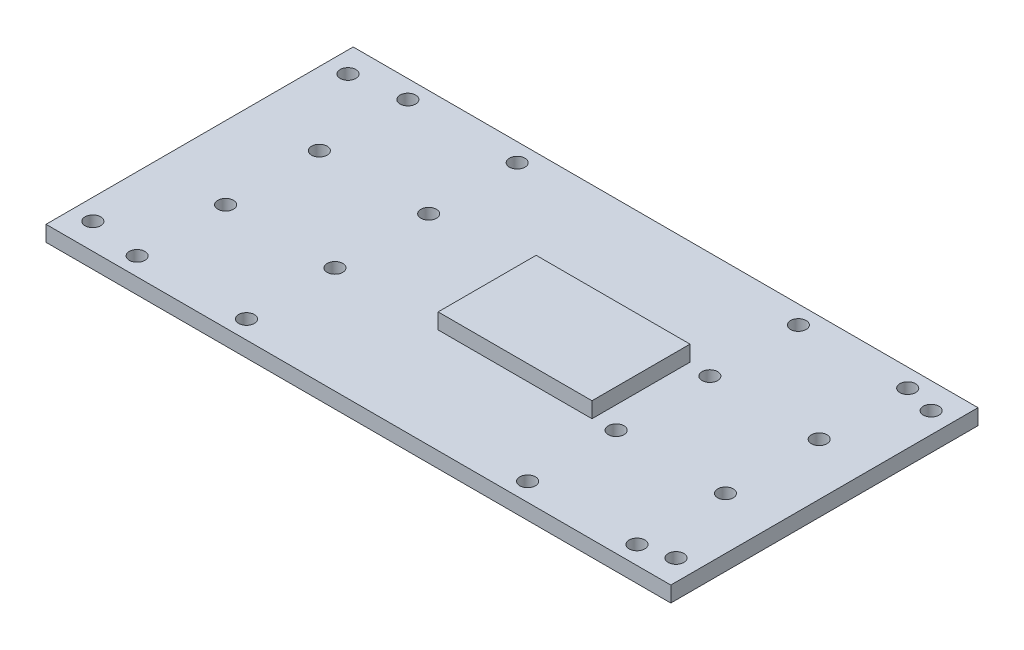
from build123d import *

# Parameters (mm, degrees)
SKETCH1_W           = 120
SKETCH1_H           = 59
SKETCH1_R           = 1.5
BOSS_EXTRUDE1_DEPTH = 3
SKETCH2_W           = 29.54925432
SKETCH2_H           = 18.825060972
BOSS_EXTRUDE2_DEPTH = 3


with BuildPart() as part:
    # Sketch1 → Boss-Extrude1 (new body)
    with BuildSketch(Plane(origin=(0, 0, 0), x_dir=(1, 0, 0), z_dir=(0, 1, 0))):
        Rectangle(SKETCH1_W, SKETCH1_H)
        with Locations((-25, 26)):
            Circle(SKETCH1_R, mode=Mode.SUBTRACT)
        with Locations((-46, 26)):
            Circle(SKETCH1_R, mode=Mode.SUBTRACT)
        with Locations((-46, 9)):
            Circle(SKETCH1_R, mode=Mode.SUBTRACT)
        with Locations((-25, 9)):
            Circle(SKETCH1_R, mode=Mode.SUBTRACT)
        with Locations((-25, -9)):
            Circle(SKETCH1_R, mode=Mode.SUBTRACT)
        with Locations((-46, -9)):
            Circle(SKETCH1_R, mode=Mode.SUBTRACT)
        with Locations((-25, -26)):
            Circle(SKETCH1_R, mode=Mode.SUBTRACT)
        with Locations((-46, -26)):
            Circle(SKETCH1_R, mode=Mode.SUBTRACT)
        with Locations((50, 26)):
            Circle(SKETCH1_R, mode=Mode.SUBTRACT)
        with Locations((29, 26)):
            Circle(SKETCH1_R, mode=Mode.SUBTRACT)
        with Locations((29, -9)):
            Circle(SKETCH1_R, mode=Mode.SUBTRACT)
        with Locations((50, -9)):
            Circle(SKETCH1_R, mode=Mode.SUBTRACT)
        with Locations((50, -26)):
            Circle(SKETCH1_R, mode=Mode.SUBTRACT)
        with Locations((29, -26)):
            Circle(SKETCH1_R, mode=Mode.SUBTRACT)
        with Locations((50, 9)):
            Circle(SKETCH1_R, mode=Mode.SUBTRACT)
        with Locations((29, 9)):
            Circle(SKETCH1_R, mode=Mode.SUBTRACT)
        with Locations((56, -24.5)):
            Circle(SKETCH1_R, mode=Mode.SUBTRACT)
        with Locations((56, 24.5)):
            Circle(SKETCH1_R, mode=Mode.SUBTRACT)
        with Locations((-56, 24.5)):
            Circle(SKETCH1_R, mode=Mode.SUBTRACT)
        with Locations((-56, -24.5)):
            Circle(SKETCH1_R, mode=Mode.SUBTRACT)
    extrude(amount=BOSS_EXTRUDE1_DEPTH)

    # Sketch2 → Boss-Extrude2 (add)
    with BuildSketch(Plane(origin=(0, 3, 0), x_dir=(1, 0, 0), z_dir=(0, 1, 0))):
        with Locations((10, 0)):
            Rectangle(SKETCH2_W, SKETCH2_H)
    extrude(amount=BOSS_EXTRUDE2_DEPTH)


solid = part.part
